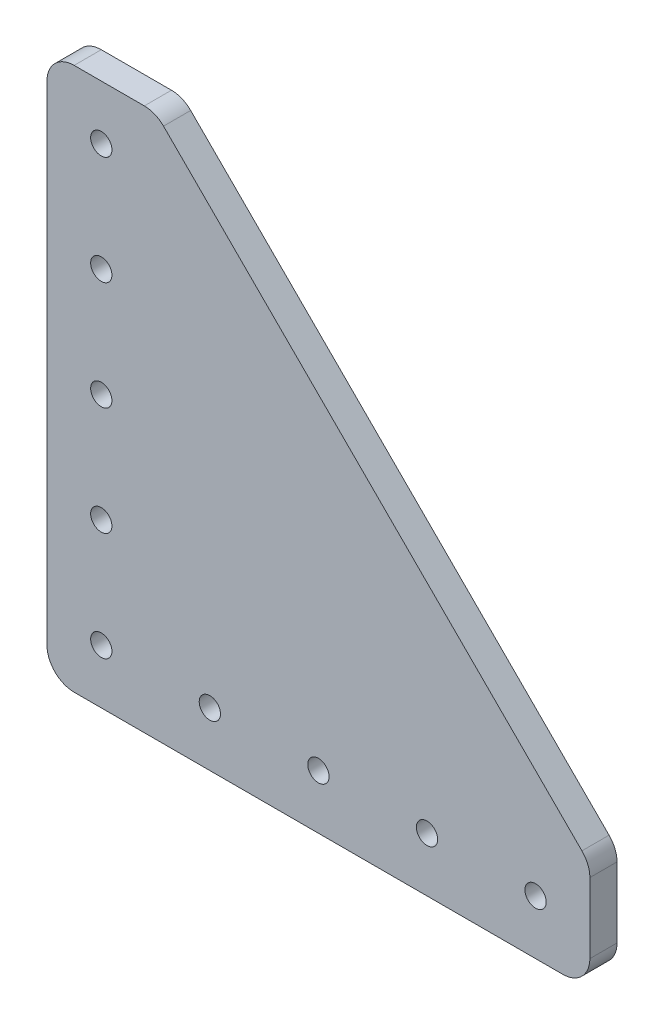
from build123d import *

# Parameters (mm, degrees)
SKETCH1_R           = 2.4892
BOSS_EXTRUDE1_DEPTH = 6.35
FILLET1_R           = 6.35


with BuildPart() as part:
    # Sketch1 → Boss-Extrude1 (new body)
    with BuildSketch(Plane.XY):
        Polygon((0, 127), (0, 0), (127, 0), (127, 25.4), (25.4, 127), align=None)
        with Locations((12.7, 12.7)):
            Circle(SKETCH1_R, mode=Mode.SUBTRACT)
        with Locations((38.1, 12.7)):
            Circle(SKETCH1_R, mode=Mode.SUBTRACT)
        with Locations((12.7, 38.1)):
            Circle(SKETCH1_R, mode=Mode.SUBTRACT)
        with Locations((63.5, 12.7)):
            Circle(SKETCH1_R, mode=Mode.SUBTRACT)
        with Locations((88.9, 12.7)):
            Circle(SKETCH1_R, mode=Mode.SUBTRACT)
        with Locations((114.3, 12.7)):
            Circle(SKETCH1_R, mode=Mode.SUBTRACT)
        with Locations((12.7, 63.5)):
            Circle(SKETCH1_R, mode=Mode.SUBTRACT)
        with Locations((12.7, 88.9)):
            Circle(SKETCH1_R, mode=Mode.SUBTRACT)
        with Locations((12.7, 114.3)):
            Circle(SKETCH1_R, mode=Mode.SUBTRACT)
    extrude(amount=BOSS_EXTRUDE1_DEPTH)

    # Fillet1
    fillet1_edges = [part.edges().sort_by_distance(p)[0] for p in [
        (0, 0, 3.175),
        (0, 127, 3.175),
        (127, 0, 3.175),
        (25.4, 127, 3.175),
        (127, 25.4, 3.175),
    ]]
    fillet(fillet1_edges, radius=FILLET1_R)


solid = part.part
